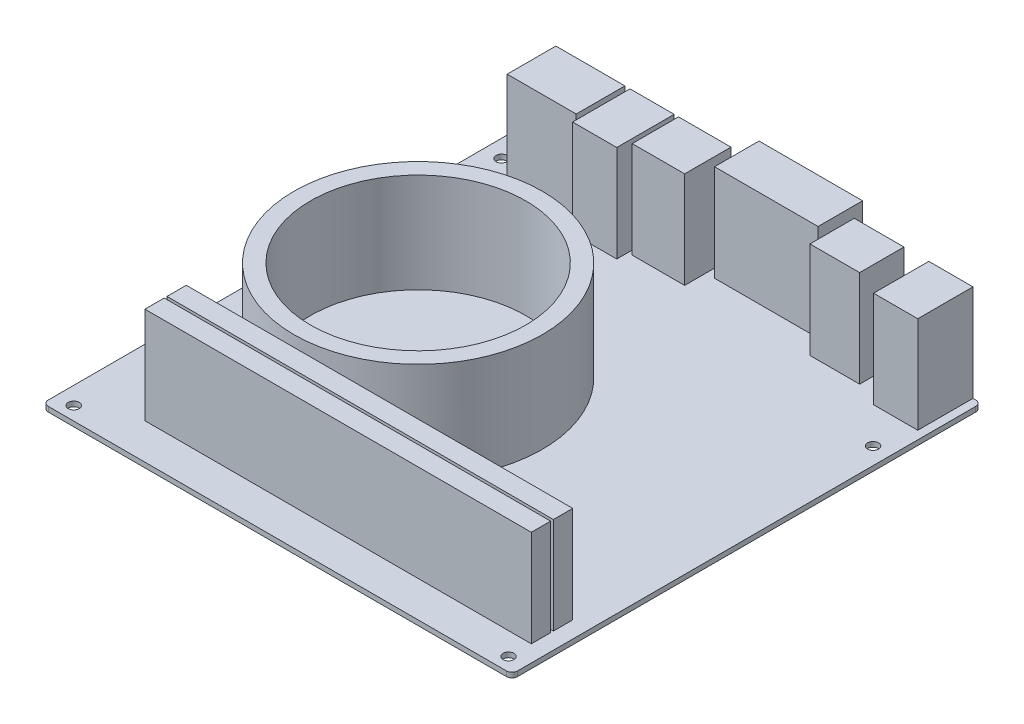
from build123d import *

# Parameters (mm, degrees)
SKETCH1_W           = 170
SKETCH1_H           = 170
BOSS_EXTRUDE1_DEPTH = 1.8
FILLET1_R           = 2
SKETCH2_R           = 1.98
CUT_EXTRUDE1_DEPTH  = 2
SKETCH3_W           = 16
SKETCH3_H           = 20
SKETCH3_W_2         = 37.5
SKETCH3_H_2         = 16.121954722
SKETCH3_W_3         = 18
SKETCH3_H_3         = 16.061076517
SKETCH3_W_4         = 19
SKETCH3_H_4         = 16.780154479
SKETCH3_H_5         = 20.801567196
SKETCH3_W_5         = 25
SKETCH3_H_6         = 17.641885776
BOSS_EXTRUDE2_DEPTH = 35
SKETCH4_W           = 140
SKETCH4_H           = 7
BOSS_EXTRUDE3_DEPTH = 35
LPATTERN1_COUNT     = 2
LPATTERN1_PITCH     = 8
SKETCH5_R           = 45
SKETCH5_R_2         = 39
BOSS_EXTRUDE4_DEPTH = 36


with BuildPart() as part:
    # Sketch1 → Boss-Extrude1 (new body)
    with BuildSketch(Plane(origin=(0, 0, 0), x_dir=(1, 0, 0), z_dir=(0, 1, 0))):
        Rectangle(SKETCH1_W, SKETCH1_H)
    extrude(amount=BOSS_EXTRUDE1_DEPTH)

    # Fillet1
    fillet1_edges = [part.edges().sort_by_distance(p)[0] for p in [
        (-85, 0.9, 85),
        (-85, 0.9, -85),
        (85, 0.9, -85),
        (85, 0.9, 85),
    ]]
    fillet(fillet1_edges, radius=FILLET1_R)

    # Sketch2 → Cut-Extrude1 (cut)
    with BuildSketch(Plane(origin=(0, 1.8, 0), x_dir=(1, 0, 0), z_dir=(0, 1, 0))):
        with Locations((-78.65, 74.84)):
            Circle(SKETCH2_R)
        with Locations((-78.65, -80.1)):
            Circle(SKETCH2_R)
        with Locations((78.83, -80.1)):
            Circle(SKETCH2_R)
        with Locations((78.83, 51.98)):
            Circle(SKETCH2_R)
    extrude(amount=-CUT_EXTRUDE1_DEPTH, mode=Mode.SUBTRACT)

    # Sketch3 → Boss-Extrude2 (add)
    with BuildSketch(Plane(origin=(0, 1.8, 0), x_dir=(1, 0, 0), z_dir=(0, 1, 0))):
        with Locations((74, 75)):
            Rectangle(SKETCH3_W, SKETCH3_H)
        with Locations((16.25, 83.939022639)):
            Rectangle(SKETCH3_W_2, SKETCH3_H_2)
        with Locations((48, 76.969461741)):
            Rectangle(SKETCH3_W_3, SKETCH3_H_3)
        with Locations((-15.17206747, 76.609922761)):
            Rectangle(SKETCH3_W_4, SKETCH3_H_4)
        with Locations((-34.244584998, 74.599216402)):
            Rectangle(SKETCH3_W, SKETCH3_H_5)
        with Locations((-56.603208404, 76.179057112)):
            Rectangle(SKETCH3_W_5, SKETCH3_H_6)
    extrude(amount=BOSS_EXTRUDE2_DEPTH)

    # Sketch4 → Boss-Extrude3 (add)
    with BuildSketch(Plane(origin=(0, 1.8, 0), x_dir=(1, 0, 0), z_dir=(0, 1, 0))):
        with Locations((9, -68.5)):
            Rectangle(SKETCH4_W, SKETCH4_H)
    boss_extrude3 = extrude(amount=BOSS_EXTRUDE3_DEPTH)

    # LPattern1: Boss-Extrude3 ×2
    with Locations(*[(0, 0, -i * LPATTERN1_PITCH) for i in range(1, LPATTERN1_COUNT)]):
        add(boss_extrude3)

    # Sketch5 → Boss-Extrude4 (add)
    with BuildSketch(Plane(origin=(0, 1.8, 0), x_dir=(1, 0, 0), z_dir=(0, 1, 0))):
        with Locations((-25, -9)):
            Circle(SKETCH5_R)
        with Locations((-25, -9)):
            Circle(SKETCH5_R_2, mode=Mode.SUBTRACT)
    extrude(amount=BOSS_EXTRUDE4_DEPTH)


solid = part.part
